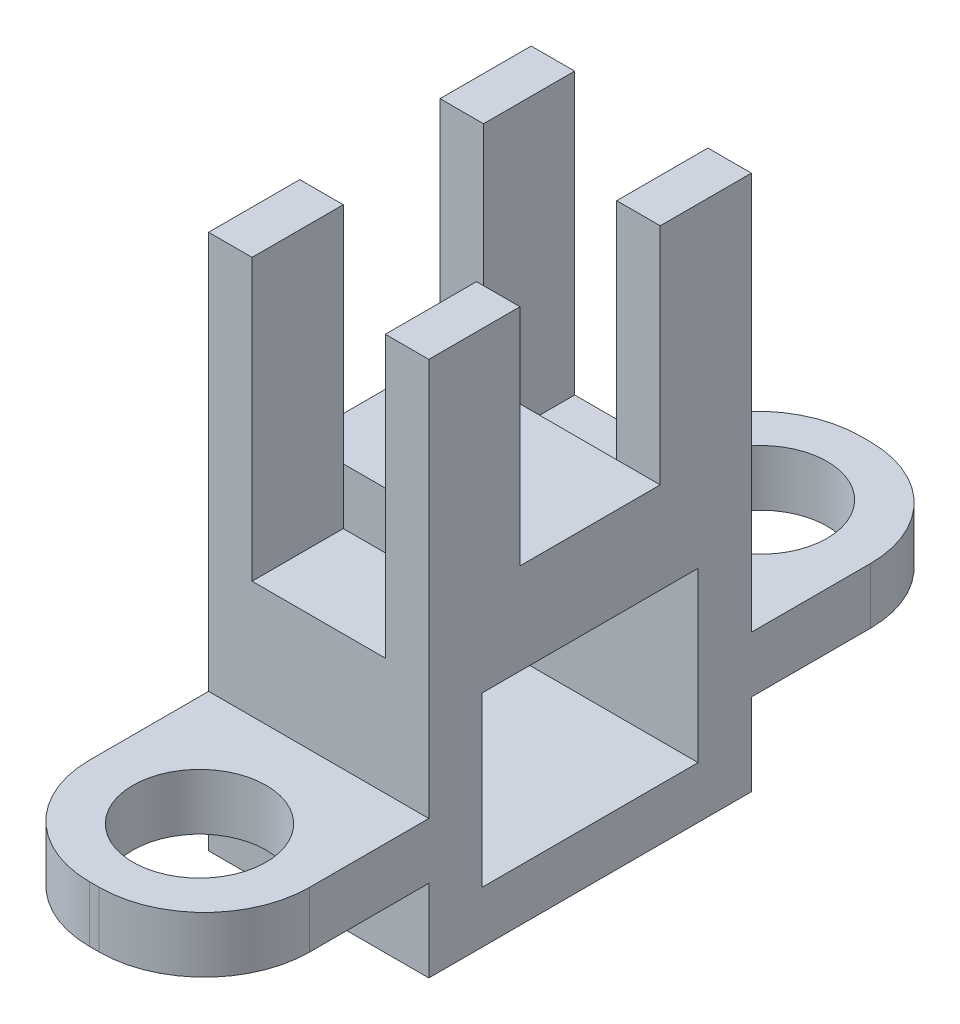
from build123d import *

# Parameters (mm, degrees)
SKETCH4_W             = 31.4
SKETCH4_H             = 31.4
SKETCH4_W_2           = 25.4
SKETCH4_H_2           = 25.4
BOSS_EXTRUDE3_DEPTH   = 30
SKETCH5_W             = 31.4
SKETCH5_H             = 31.4
BOSS_EXTRUDE4_DEPTH   = 5
SKETCH6_W             = 31.4
SKETCH6_H             = 8
BOSS_EXTRUDE5_DEPTH   = 5
BOSS_EXTRUDE6_DEPTH   = 8
SKETCH8_R             = 9.5
BOSS_EXTRUDE7_DEPTH   = 8
SKETCH9_W             = 31.4
SKETCH9_H             = 10
BOSS_EXTRUDE8_DEPTH   = 5
SKETCH10_W            = 31.4
SKETCH10_H            = 10
BOSS_EXTRUDE9_DEPTH   = 13
SKETCH11_W            = 6.2
SKETCH11_H            = 10
BOSS_EXTRUDE10_DEPTH  = 40
BOSS_EXTRUDE11_DEPTH  = 3
SKETCH13_W            = 31.4
SKETCH13_H            = 31.4
CUT_EXTRUDE1_DEPTH    = 31.4
SKETCH14_W            = 31.4
SKETCH14_H            = 31.4
BOSS_EXTRUDE12_DEPTH  = 4
SKETCH16_W            = 31.4
SKETCH16_H            = 8
BOSS_EXTRUDE13_DEPTH  = 15.4
CUT_EXTRUDE3_START    = 8
SKETCH8_2_R           = 9.5
CUT_EXTRUDE3_DEPTH    = 24
MIRROR2_START         = -15.7
MIRROR2_DEPTH         = 36.4
MIRROR2_START_2       = 12.7
MIRROR2_2_OUTLINE_W   = 6.2
MIRROR2_2_OUTLINE_H   = 13
MIRROR2_2_DEPTH       = 48
MIRROR2_START_3       = -4
MIRROR2_3_OUTLINE_R   = 9.5
MIRROR2_3_DEPTH       = 8
MIRROR2_4_OUTLINE_W   = 31.4
MIRROR2_4_OUTLINE_H   = 10
MIRROR2_4_DEPTH       = 16
MIRROR2_5_OUTLINE_W   = 25.4
MIRROR2_5_OUTLINE_H   = 15.4
MIRROR2_5_DEPTH       = 8
MIRROR2_6_OUTLINE_W   = 25.4
MIRROR2_6_OUTLINE_H   = 12
MIRROR2_6_OUTLINE_W_2 = 19
MIRROR2_6_OUTLINE_H_2 = 5.4
MIRROR2_6_DEPTH       = 8
SKETCH17_W            = 30.8
SKETCH17_H            = 24
CUT_EXTRUDE2_DEPTH    = 31.4


# Read off the part's stored shape, not the designer's step: Mirror2
with BuildPart() as part:
    # Sketch4 → Boss-Extrude3 (new body)
    with BuildSketch(Plane.XY):
        Rectangle(SKETCH4_W, SKETCH4_H)
        Rectangle(SKETCH4_W_2, SKETCH4_H_2, mode=Mode.SUBTRACT)
    extrude(amount=BOSS_EXTRUDE3_DEPTH)

    # Sketch5 → Boss-Extrude4 (add)
    with BuildSketch(Plane.XY.offset(30)):
        Rectangle(SKETCH5_W, SKETCH5_H)
    extrude(amount=BOSS_EXTRUDE4_DEPTH)

    # Sketch6 → Boss-Extrude5 (add)
    with BuildSketch(Plane.XY.offset(35)):
        Rectangle(SKETCH6_W, SKETCH6_H)
    extrude(amount=BOSS_EXTRUDE5_DEPTH)

    # Sketch7 → Boss-Extrude6 (add)
    with BuildSketch(Plane.XZ.offset(4)):
        with BuildLine():
            Line((-15.7, 40), (-15.7, 52))
            ThreePointArc((-15.7, 52), (-11.306601718, 62.606601718), (-0.7, 67))
            Line((-0.7, 67), (0.7, 67))
            ThreePointArc((0.7, 67), (11.306601718, 62.606601718), (15.7, 52))
            Line((15.7, 52), (15.7, 40))
            Line((15.7, 40), (-15.7, 40))
        make_face()
    extrude(amount=-BOSS_EXTRUDE6_DEPTH)

    # Sketch8 → Boss-Extrude7 (add)
    with BuildSketch(Plane.XZ.offset(4)):
        with Locations(Location((0, 52, 0), (0, 0, 180))):
            Circle(SKETCH8_R)
    boss_extrude7 = extrude(amount=BOSS_EXTRUDE7_DEPTH)

    # Mirror1: Boss-Extrude7 across plane
    add(boss_extrude7.mirror(Plane.ZX))

    # Sketch9 → Boss-Extrude8 (add)
    with BuildSketch(Plane(origin=(0, 15.7, 0), x_dir=(1, 0, 0), z_dir=(0, 1, 0))):
        with Locations((0, -27)):
            Rectangle(SKETCH9_W, SKETCH9_H)
    extrude(amount=BOSS_EXTRUDE8_DEPTH)

    # Sketch10 → Boss-Extrude9 (add)
    with BuildSketch(Plane(origin=(0, 15.7, 0), x_dir=(1, 0, 0), z_dir=(0, 1, 0))):
        with Locations((0, -17)):
            Rectangle(SKETCH10_W, SKETCH10_H)
    extrude(amount=BOSS_EXTRUDE9_DEPTH)

    # Sketch11 → Boss-Extrude10 (add)
    with BuildSketch(Plane(origin=(0, 20.7, 0), x_dir=(1, 0, 0), z_dir=(0, 1, 0))):
        with Locations((-12.6, -27)):
            Rectangle(SKETCH11_W, SKETCH11_H)
        with Locations((12.6, -27)):
            Rectangle(SKETCH11_W, SKETCH11_H)
    extrude(amount=BOSS_EXTRUDE10_DEPTH)

    # Sketch12 → Boss-Extrude11 (add)
    with BuildSketch(Plane.XY.offset(32)):
        Polygon((-15.7, 60.7), (-9.5, 60.7), (-9.5, 20.7), (9.5, 20.7), (9.5, 60.7), (15.7, 60.7), (15.7, 15.7), (-15.7, 15.7), align=None)
    extrude(amount=BOSS_EXTRUDE11_DEPTH)

    # Sketch13 → Cut-Extrude1 (cut)
    with BuildSketch(Plane.ZY.offset(15.7)):
        with Locations((15.7, 0)):
            Rectangle(SKETCH13_W, SKETCH13_H)
    extrude(amount=-CUT_EXTRUDE1_DEPTH, mode=Mode.SUBTRACT)

    # Sketch14 → Boss-Extrude12 (add)
    with BuildSketch(Plane(origin=(0, 0, 31.4), x_dir=(-1, 0, 0), z_dir=(0, 0, -1))):
        Rectangle(SKETCH14_W, SKETCH14_H)
    extrude(amount=BOSS_EXTRUDE12_DEPTH)

    # Sketch16 → Boss-Extrude13 (add)
    with BuildSketch(Plane(origin=(0, 0, 27.4), x_dir=(-1, 0, 0), z_dir=(0, 0, -1))):
        with Locations((0, -11.7)):
            Rectangle(SKETCH16_W, SKETCH16_H)
    extrude(amount=BOSS_EXTRUDE13_DEPTH)

    # Sketch8<2> → Cut-Extrude3 (cut)
    with BuildSketch(Plane.XZ.offset(4).offset(CUT_EXTRUDE3_START)):
        with Locations(Location((0, 52, 0), (0, 0, 270))):
            Circle(SKETCH8_2_R)
    extrude(amount=-CUT_EXTRUDE3_DEPTH, mode=Mode.SUBTRACT)

    # Mirror2 outline → Mirror2 (add)
    with BuildSketch(Plane(origin=(0, 0, 0), x_dir=(1, 0, 0), z_dir=(0, 1, 0)).offset(MIRROR2_START)):
        Polygon((12.7, -24), (15.7, -24), (15.7, 11), (-15.7, 11), (-15.7, -24), (-12.7, -24), (-12.7, 3.4), (12.7, 3.4), align=None)
    extrude(amount=MIRROR2_DEPTH)

    # Mirror2 2 outline → Mirror2 2 (add)
    with BuildSketch(Plane(origin=(0, 0, 0), x_dir=(1, 0, 0), z_dir=(0, 1, 0)).offset(MIRROR2_START_2)):
        with Locations((12.6, 4.5)):
            Rectangle(MIRROR2_2_OUTLINE_W, MIRROR2_2_OUTLINE_H)
        with Locations((-12.6, 4.5)):
            Rectangle(MIRROR2_2_OUTLINE_W, MIRROR2_2_OUTLINE_H)
    extrude(amount=MIRROR2_2_DEPTH)

    # Mirror2 3 outline → Mirror2 3 (add)
    with BuildSketch(Plane(origin=(0, 0, 0), x_dir=(1, 0, 0), z_dir=(0, 1, 0)).offset(MIRROR2_START_3)):
        with BuildLine():
            Line((-15.7, 11), (15.7, 11))
            Line((15.7, 11), (15.7, 28))
            ThreePointArc((15.7, 28), (11.306601718, 38.606601718), (0.7, 43))
            Line((0.7, 43), (-0.7, 43))
            ThreePointArc((-0.7, 43), (-11.306601718, 38.606601718), (-15.7, 28))
            Line((-15.7, 28), (-15.7, 11))
        make_face()
        with Locations((0, 28)):
            Circle(MIRROR2_3_OUTLINE_R, mode=Mode.SUBTRACT)
    extrude(amount=MIRROR2_3_DEPTH)

    # Mirror2 4 outline → Mirror2 4 (add)
    with BuildSketch(Plane(origin=(0, 0, 0), x_dir=(1, 0, 0), z_dir=(0, 1, 0)).offset(MIRROR2_START_2)):
        with Locations((0, -7)):
            Rectangle(MIRROR2_4_OUTLINE_W, MIRROR2_4_OUTLINE_H)
    extrude(amount=MIRROR2_4_DEPTH)

    # Mirror2 5 outline → Mirror2 5 (add)
    with BuildSketch(Plane(origin=(0, 0, 0), x_dir=(1, 0, 0), z_dir=(0, 1, 0)).offset(MIRROR2_START)):
        with Locations((0, -4.3)):
            Rectangle(MIRROR2_5_OUTLINE_W, MIRROR2_5_OUTLINE_H)
    extrude(amount=MIRROR2_5_DEPTH)

    # Mirror2 6 outline → Mirror2 6 (add)
    with BuildSketch(Plane(origin=(0, 0, 0), x_dir=(1, 0, 0), z_dir=(0, 1, 0)).offset(MIRROR2_START_2)):
        with Locations((0, -18)):
            Rectangle(MIRROR2_6_OUTLINE_W, MIRROR2_6_OUTLINE_H)
        with Locations((0, 0.7)):
            Rectangle(MIRROR2_6_OUTLINE_W_2, MIRROR2_6_OUTLINE_H_2)
    extrude(amount=MIRROR2_6_DEPTH)

    # Sketch17 → Cut-Extrude2 (cut)
    with BuildSketch(Plane.ZY.offset(15.7)):
        with Locations((12, 3.7)):
            Rectangle(SKETCH17_W, SKETCH17_H)
    extrude(amount=-CUT_EXTRUDE2_DEPTH, mode=Mode.SUBTRACT)


solid = part.part
